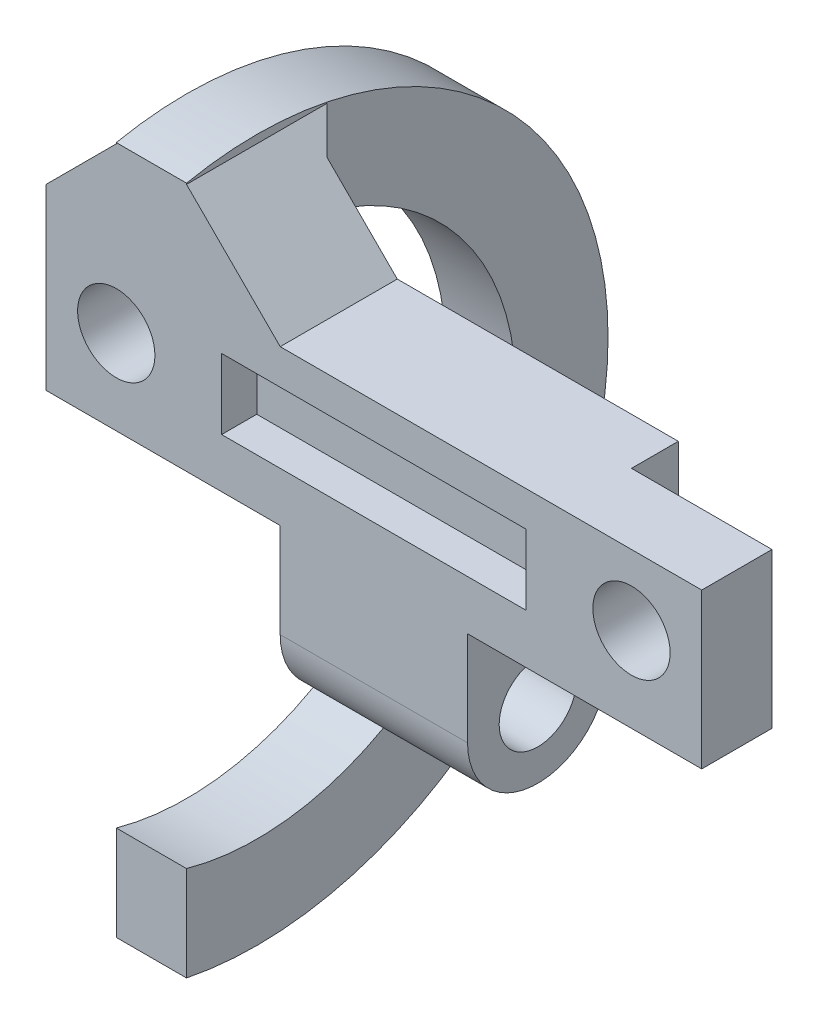
from build123d import *

# Parameters (mm, degrees)
SZKIC1_W                    = 28
SZKIC1_H                    = 6
SZKIC1_R                    = 1.65
DODANIE_WYCI_GNI_CIE1_DEPTH = 3
SZKIC2_W                    = 28
SZKIC2_H                    = 3
DODANIE_WYCI_GNI_CIE2_DEPTH = 3
SZKIC3_R                    = 1.65
DODANIE_WYCI_GNI_CIE4_DEPTH = 28
WYTNIJ_WYCI_GNI_CIE2_DEPTH  = 10
SFAZOWANIE1_START           = -14
SFAZOWANIE1_DEPTH           = 28
SFAZOWANIE1_START_2         = -4
SFAZOWANIE1_2_DEPTH         = 8
SZKIC5_W                    = 0.893182681
SZKIC5_H                    = 1.710314622
WYTNIJ_WYCI_GNI_CIE3_DEPTH  = 10
SZKIC6_W                    = 13
SZKIC6_H                    = 3
WYTNIJ_WYCI_GNI_CIE4_DEPTH  = 1.5
DODANIE_WYCI_GNI_CIE5_DEPTH = 6
SZKIC9_R                    = 15
WYTNIJ_WYCI_GNI_CIE5_DEPTH  = 3
SFAZOWANIE2_SIZE            = 4
SFAZOWANIE3_SIZE            = 4
DODANIE_WYCI_GNI_CIE6_DEPTH = 2
SFAZOWANIE4_SIZE            = 1
SFAZOWANIE5_SIZE            = 1
DODANIE_WYCI_GNI_CIE7_DEPTH = 8


with BuildPart() as part:
    # Szkic1 → Dodanie-wyciągnięcie1 (new body)
    with BuildSketch(Plane.XY):
        Rectangle(SZKIC1_W, SZKIC1_H)
        with Locations((11, 0)):
            Circle(SZKIC1_R, mode=Mode.SUBTRACT)
        with Locations((-11, 0)):
            Circle(SZKIC1_R, mode=Mode.SUBTRACT)
    extrude(amount=DODANIE_WYCI_GNI_CIE1_DEPTH)

    # Szkic2 → Dodanie-wyciągnięcie2 (add)
    with BuildSketch(Plane.XZ.offset(3)):
        with Locations((0, 1.5)):
            Rectangle(SZKIC2_W, SZKIC2_H)
    extrude(amount=DODANIE_WYCI_GNI_CIE2_DEPTH)

    # Szkic3 → Dodanie-wyciągnięcie4 (add)
    with BuildSketch(Plane(origin=(14, 0, 0), x_dir=(0, 0, -1), z_dir=(1, 0, 0))):
        with BuildLine():
            Line((0, -4.65), (-3, -4.65))
            Line((-3, -4.65), (-3, -7.65))
            ThreePointArc((-3, -7.65), (2.121320344, -9.771320344), (0, -4.65))
        make_face()
        with Locations(Location((0, -7.65, 0), (0, 0, 90))):
            Circle(SZKIC3_R, mode=Mode.SUBTRACT)
    extrude(amount=-DODANIE_WYCI_GNI_CIE4_DEPTH)

    # Szkic4 → Wytnij-wyciągnięcie2 (cut)
    with BuildSketch(Plane.ZY.offset(14)):
        Polygon((-3.162330393, -4.65), (-3.162330393, -3.615751975), (3, -3.615751975), (3, -4.65), (3, -10.796501094), (-3.162330393, -10.796501094), align=None)
    wytnij_wyci_gni_cie2 = extrude(amount=-WYTNIJ_WYCI_GNI_CIE2_DEPTH, mode=Mode.SUBTRACT)

    # Lustro1: Wytnij-wyciągnięcie2 across plane
    add(wytnij_wyci_gni_cie2.mirror(Plane(origin=(0, 0, 0), x_dir=(0, 0, 1), z_dir=(1, 0, 0))), mode=Mode.SUBTRACT)

    # Sfazowanie1: read off the stored shape, not the designer's step
    # Sfazowanie1 outline → Sfazowanie1 (add)
    with BuildSketch(Plane.YZ.offset(SFAZOWANIE1_START)):
        Polygon((-3.615751975, 0), (-3.615751975, -0.893182681), (-1.905437353, 0), align=None)
    extrude(amount=SFAZOWANIE1_DEPTH)

    # Sfazowanie1 2 outline → Sfazowanie1 2 (add)
    with BuildSketch(Plane.YZ.offset(SFAZOWANIE1_START_2)):
        with BuildLine():
            Line((-5.18804458, -1.714285714), (-3.615751975, -0.893182681))
            Line((-3.615751975, -0.893182681), (-3.615751975, 0))
            Line((-3.615751975, 0), (-4.65, 0))
            ThreePointArc((-4.65, 0), (-4.787669982, -0.898369005), (-5.18804458, -1.714285714))
        make_face()
    extrude(amount=SFAZOWANIE1_2_DEPTH)

    # Szkic5 → Wytnij-wyciągnięcie3 (cut)
    with BuildSketch(Plane(origin=(14, 0, 0), x_dir=(0, 0, -1), z_dir=(1, 0, 0))):
        with Locations((0.446591341, -2.760594664)):
            Rectangle(SZKIC5_W, SZKIC5_H)
    wytnij_wyci_gni_cie3 = extrude(amount=-WYTNIJ_WYCI_GNI_CIE3_DEPTH, mode=Mode.SUBTRACT)

    # Lustro2: Wytnij-wyciągnięcie3 across plane
    add(wytnij_wyci_gni_cie3.mirror(Plane(origin=(0, 0, 0), x_dir=(0, 0, 1), z_dir=(1, 0, 0))), mode=Mode.SUBTRACT)

    # Szkic6 → Wytnij-wyciągnięcie4 (cut)
    with BuildSketch(Plane.XY.offset(3)):
        Rectangle(SZKIC6_W, SZKIC6_H)
    extrude(amount=-WYTNIJ_WYCI_GNI_CIE4_DEPTH, mode=Mode.SUBTRACT)

    # Szkic8 → Dodanie-wyciągnięcie5 (add)
    with BuildSketch(Plane.ZY.offset(14)):
        with BuildLine():
            Line((3, 3), (3, 7.046938457))
            ThreePointArc((3, 7.046938457), (-15, -7.65), (3, -22.346938457))
            Line((3, -22.346938457), (3, -18.3))
            ThreePointArc((3, -18.3), (-10.65, -10.65), (-3, 3))
            Line((-3, 3), (0, 3))
            Line((0, 3), (3, 3))
        make_face()
    extrude(amount=-DODANIE_WYCI_GNI_CIE5_DEPTH)

    # Szkic9 → Wytnij-wyciągnięcie5 (cut)
    with BuildSketch(Plane.ZY.offset(14)):
        with Locations((0, -7.65)):
            Circle(SZKIC9_R)
        with BuildLine():
            Line((-3, 3), (3, 3))
            ThreePointArc((3, 3), (0, -18.714470164), (-3, 3))
        make_face(mode=Mode.SUBTRACT)
    extrude(amount=-WYTNIJ_WYCI_GNI_CIE5_DEPTH, mode=Mode.SUBTRACT)

    # Sfazowanie2
    sfazowanie2_edges = [part.edges().sort_by_distance(p)[0] for p in [
        (-8, 3, 1.5),
    ]]
    chamfer(sfazowanie2_edges, length=SFAZOWANIE2_SIZE)

    # Sfazowanie3
    # the kernel refuses this chamfer: 4 mm, written as the material it adds along each edge
    with BuildSketch(Plane(origin=(-11, 3, 0), x_dir=(-1, 0, 0), z_dir=(0, 0, 1))) as sfazowanie3_piece_1_section:
        Polygon((SFAZOWANIE3_SIZE, 0), (0, -SFAZOWANIE3_SIZE), (0, 0), align=None)
    sfazowanie3_piece_1 = extrude(amount=3, mode=Mode.PRIVATE)
    sfazowanie3_piece_1 = split(sfazowanie3_piece_1, bisect_by=Plane(origin=(-14, 3, 0), z_dir=(1, 0, 0)), keep=Keep.TOP, mode=Mode.PRIVATE)
    add(sfazowanie3_piece_1)

    # Szkic10 → Dodanie-wyciągnięcie6 (add)
    with BuildSketch(Plane(origin=(0, 0, 0), x_dir=(-1, 0, 0), z_dir=(0, 0, -1))):
        Polygon((-8, 3), (-8, -3.615751975), (8, -3.615751975), (8, 3.615751975), (8, 7), (4, 3), align=None)
    extrude(amount=DODANIE_WYCI_GNI_CIE6_DEPTH)

    # Sfazowanie4
    sfazowanie4_edges = [part.edges().sort_by_distance(p)[0] for p in [
        (-8, 5, -2),
    ]]
    chamfer(sfazowanie4_edges, length=SFAZOWANIE4_SIZE)

    # Sfazowanie5
    sfazowanie5_edges = [part.edges().sort_by_distance(p)[0] for p in [
        (-11, 5, 0),
    ]]
    chamfer(sfazowanie5_edges, length=SFAZOWANIE5_SIZE)

    # Szkic11 → Dodanie-wyciągnięcie7 (add)
    with BuildSketch(Plane(origin=(4, 0, 0), x_dir=(0, 0, -1), z_dir=(1, 0, 0))):
        Polygon((2, -3.615751975), (2, -5.632292806), (0.35679852, -3.615751975), align=None)
    extrude(amount=-DODANIE_WYCI_GNI_CIE7_DEPTH)


solid = part.part
